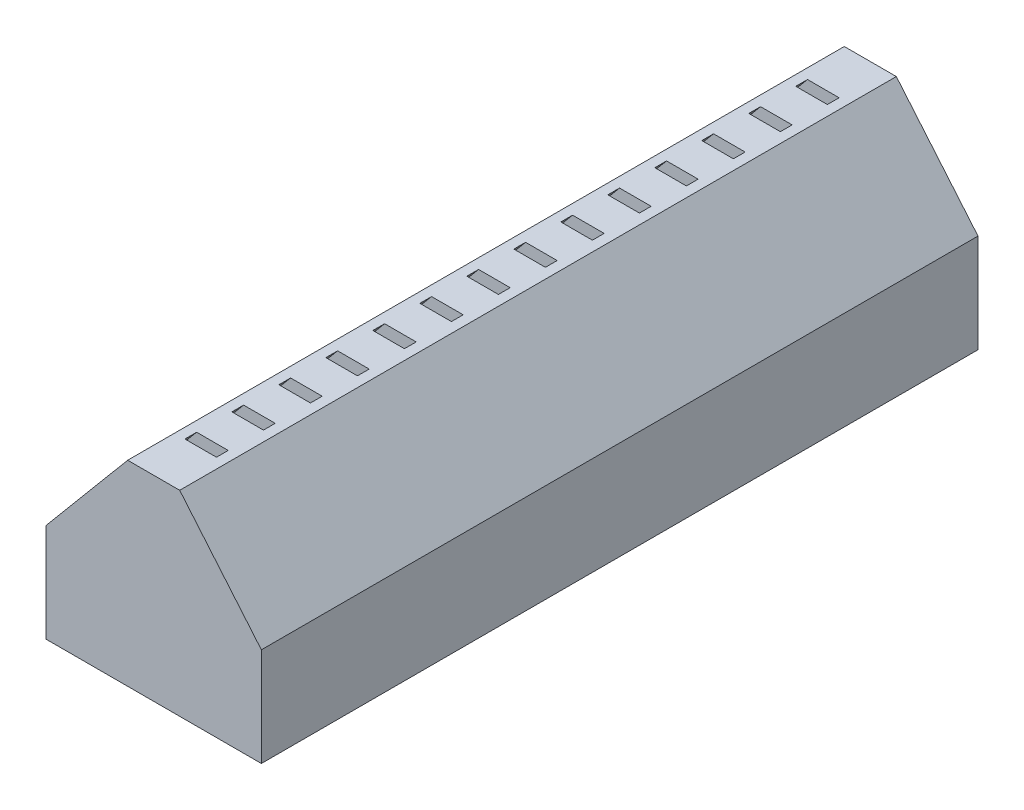
from build123d import *

# Parameters (mm, degrees)
AUFSATZ_LINEAR_AUSTRAGEN2_DEPTH      = 1.8
SCHNITT_LINEAR_AUSTRAGEN1_DEPTH      = 0.5
SCHNITT_LINEAR_AUSTRAGEN2_DEPTH      = 21.328305389
AUFSATZ_LINEAR_AUSTRAGEN3_DEPTH      = 1.2
LINEARES_MUSTER1_COUNT               = 15
LINEARES_MUSTER1_PITCH               = 4.8
AUFSATZ_LINEAR_AUSTRAGEN4_DEPTH      = 1.2
AUFSATZ_LINEAR_AUSTRAGEN4_DEPTH_BACK = 1.3
AUFSATZ_LINEAR_AUSTRAGEN5_DEPTH      = 1.2
AUFSATZ_LINEAR_AUSTRAGEN5_DEPTH_BACK = 0.8
AUFSATZ_LINEAR_START                 = -2.5
AUFSATZ_LINEAR_AUSTRAGEN7_DEPTH      = 2.5


with BuildPart() as part:
    # Skizze3 → Aufsatz-Linear austragen2 (new, symmetric)
    with BuildSketch(Plane.XY):
        Polygon((-11, -3), (-11, 7.057881962), (-2.657572421, 17), (2.657572421, 17), (11, 7.057881962), (11, -3), align=None)
    aufsatz_linear_austragen2 = extrude(amount=AUFSATZ_LINEAR_AUSTRAGEN2_DEPTH, both=True)

    # Skizze2 → Schnitt-Linear austragen1 (cut, symmetric)
    with BuildSketch(Plane.XY):
        Polygon((-8, 0), (8, 0), (8, 5.965971259), (0, 15.5), (-8, 5.965971259), align=None)
    schnitt_linear_austragen1 = extrude(amount=SCHNITT_LINEAR_AUSTRAGEN1_DEPTH, both=True, mode=Mode.SUBTRACT)

    # Skizze5 → Schnitt-Linear austragen2 (cut, symmetric)
    with BuildSketch(Plane.XY):
        Polygon((-0.75, 0), (0, 0.893815194), (0.75, 0), (0.75, -1.5), (-0.75, -1.5), align=None)
    schnitt_linear_austragen2 = extrude(amount=SCHNITT_LINEAR_AUSTRAGEN2_DEPTH, both=True, mode=Mode.SUBTRACT)

    # Skizze6 → Aufsatz-Linear austragen3 (add)
    with BuildSketch(Plane.XY.offset(1.8)):
        Polygon((-1.61324659, 17), (-2.657572421, 17), (-11, 7.057881962), (-11, -3), (11, -3), (11, 7.057881962), (2.657572421, 17), (1.61324659, 17), (10.2, 6.766705775), (10.2, 2), (-10.2, 2), (-10.2, 6.766705775), align=None)
        Polygon((-0.75, 0), (0, 0.893815194), (0.75, 0), (0.75, -1.5), (-0.75, -1.5), align=None, mode=Mode.SUBTRACT)
    aufsatz_linear_austragen3 = extrude(amount=AUFSATZ_LINEAR_AUSTRAGEN3_DEPTH)

    # Lineares Muster1: Aufsatz-Linear austragen2, Schnitt-Linear austragen1, Schnitt-Linear austragen2, Aufsatz-Linear austragen3 ×15
    with Locations(*[(0, 0, i * LINEARES_MUSTER1_PITCH) for i in range(1, LINEARES_MUSTER1_COUNT)]):
        add(aufsatz_linear_austragen2)
        add(schnitt_linear_austragen1, mode=Mode.SUBTRACT)
        add(schnitt_linear_austragen2, mode=Mode.SUBTRACT)
        add(aufsatz_linear_austragen3)

    # Skizze8 → Aufsatz-Linear austragen4 (add, two sides: drawn at the far end of the back side and taken through both)
    with BuildSketch(Plane(origin=(0, 0, -1.8), x_dir=(-1, 0, 0), z_dir=(0, 0, -1)).offset(-AUFSATZ_LINEAR_AUSTRAGEN4_DEPTH_BACK)):
        Polygon((11, -3), (11, 7.057881962), (2.657572421, 17), (-2.657572421, 17), (-11, 7.057881962), (-11, -3), align=None)
    extrude(amount=AUFSATZ_LINEAR_AUSTRAGEN4_DEPTH + AUFSATZ_LINEAR_AUSTRAGEN4_DEPTH_BACK)

    # Skizze9 → Aufsatz-Linear austragen5 (add, two sides: drawn at the far end of the back side and taken through both)
    with BuildSketch(Plane.XY.offset(69).offset(-AUFSATZ_LINEAR_AUSTRAGEN5_DEPTH_BACK)):
        Polygon((1.61324659, 17), (-1.61324659, 17), (-10.2, 6.766705775), (-10.2, 2), (10.2, 2), (10.2, 6.766705775), align=None)
    extrude(amount=AUFSATZ_LINEAR_AUSTRAGEN5_DEPTH + AUFSATZ_LINEAR_AUSTRAGEN5_DEPTH_BACK)

    # Skizze12 → Aufsatz-Linear austragen7 (add)
    with BuildSketch(Plane.XY.offset(70.2).offset(AUFSATZ_LINEAR_START)):
        Polygon((-0.75, -1.5), (-0.75, 0), (0, 0.893815194), (0.75, 0), (0.75, -1.5), align=None)
    extrude(amount=AUFSATZ_LINEAR_AUSTRAGEN7_DEPTH)


solid = part.part
